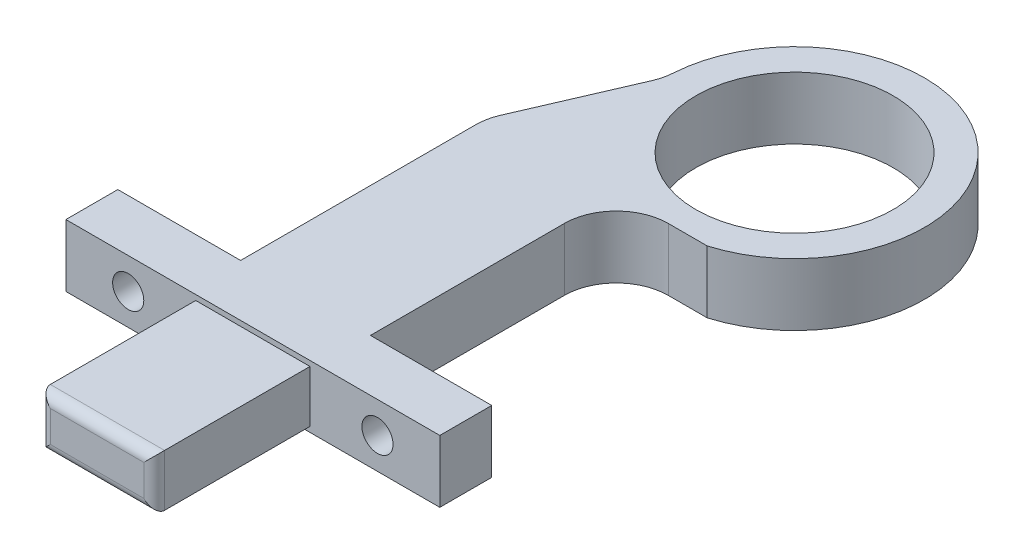
from build123d import *

# Parameters (mm, degrees)
CROQUIS1_R              = 9.5
SALIENTE_EXTRUIR1_DEPTH = 6
CROQUIS2_R              = 1.5
CORTAR_EXTRUIR1_DEPTH   = 6
CROQUIS3_W              = 11
CROQUIS3_H              = 15
CORTAR_EXTRUIR2_DEPTH   = 0.5
CROQUIS4_W              = 11
CROQUIS4_H              = 15
CORTAR_EXTRUIR3_DEPTH   = 0.5
REDONDEO1_R             = 1


with BuildPart() as part:
    # Croquis1 → Saliente-Extruir1 (new body)
    with BuildSketch(Plane(origin=(0, 0, 0), x_dir=(1, 0, 0), z_dir=(0, 1, 0))):
        with BuildLine():
            Line((-25.374701647, 20.783734094), (-29.767291136, 10.621141392))
            ThreePointArc((-29.767291136, 10.621141392), (-29.942112128, 10.153967486), (-30.069514751, 9.671699501))
            ThreePointArc((-30.069514751, 9.671699501), (-30.150557328, 9.157351254), (-30.17766953, 8.637363805))
            Line((-30.17766953, 8.637363805), (-30.17766953, -14))
            Line((-30.17766953, -14), (-42, -14))
            Line((-42, -14), (-42, -19))
            Line((-42, -19), (-29.5, -19))
            Line((-29.5, -19), (-29.5, -34))
            Line((-29.5, -34), (-18.5, -34))
            Line((-18.5, -34), (-18.5, -19))
            Line((-18.5, -19), (-6, -19))
            Line((-6, -19), (-6, -14))
            Line((-6, -14), (-17.67766953, -14))
            Line((-17.67766953, -14), (-17.67766953, 4.671699501))
            ThreePointArc((-17.67766953, 4.671699501), (-16.213203436, 8.207233407), (-12.67766953, 9.671699501))
            Line((-12.67766953, 9.671699501), (-8.928571429, 9.671699501))
            ThreePointArc((-8.928571429, 9.671699501), (-4.713647249, 31.429321655), (-24.974516609, 22.448404084))
            ThreePointArc((-24.974516609, 22.448404084), (-25.102827296, 21.598812807), (-25.374701647, 20.783734094))
        make_face()
        with Locations((-12.5, 21.650635095)):
            Circle(CROQUIS1_R, mode=Mode.SUBTRACT)
    extrude(amount=SALIENTE_EXTRUIR1_DEPTH)

    # Croquis2 → Cortar-Extruir1 (cut)
    with BuildSketch(Plane.XY.offset(19)):
        with Locations((-36, 3)):
            Circle(CROQUIS2_R)
        with Locations((-12, 3)):
            Circle(CROQUIS2_R)
    extrude(amount=-CORTAR_EXTRUIR1_DEPTH, mode=Mode.SUBTRACT)

    # Croquis3 → Cortar-Extruir2 (cut)
    with BuildSketch(Plane(origin=(0, 6, 0), x_dir=(1, 0, 0), z_dir=(0, 1, 0))):
        with Locations((-24, -26.5)):
            Rectangle(CROQUIS3_W, CROQUIS3_H)
    extrude(amount=-CORTAR_EXTRUIR2_DEPTH, mode=Mode.SUBTRACT)

    # Croquis4 → Cortar-Extruir3 (cut)
    with BuildSketch(Plane.XZ):
        with Locations((-24, 26.5)):
            Rectangle(CROQUIS4_W, CROQUIS4_H)
    extrude(amount=-CORTAR_EXTRUIR3_DEPTH, mode=Mode.SUBTRACT)

    # Redondeo1
    redondeo1_edges = [part.edges().sort_by_distance(p)[0] for p in [
        (-29.5, 3, 34),
        (-24, 5.5, 34),
        (-18.5, 3, 34),
        (-24, 0.5, 34),
    ]]
    fillet(redondeo1_edges, radius=REDONDEO1_R)


solid = part.part
